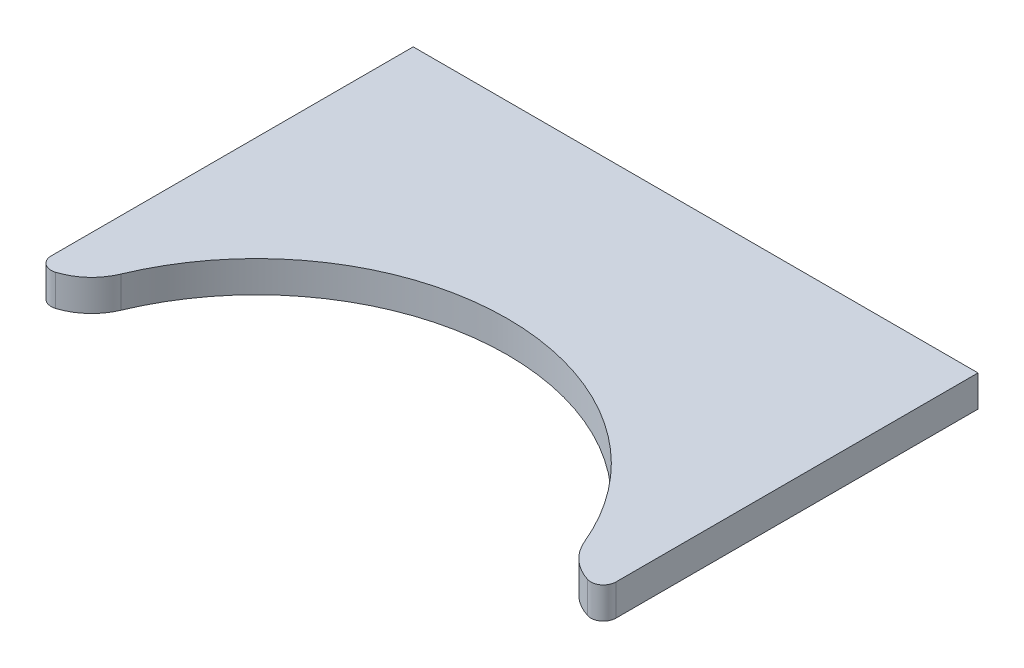
from build123d import *

# Parameters (mm, degrees)
SKETCH1_W           = 57.15
SKETCH1_H           = 38.1
BOSS_EXTRUDE1_DEPTH = 3.175
CUT_EXTRUDE1_DEPTH  = 35.48932806
FILLET3_R           = 1.27


with BuildPart() as part:
    # Sketch1 → Boss-Extrude1 (new body)
    with BuildSketch(Plane(origin=(0, 0, 0), x_dir=(1, 0, 0), z_dir=(0, 1, 0))):
        Rectangle(SKETCH1_W, SKETCH1_H)
    extrude(amount=BOSS_EXTRUDE1_DEPTH)

    # Sketch2 → Cut-Extrude1 (cut, through all)
    with BuildSketch(Plane(origin=(0, 3.175, 0), x_dir=(1, 0, 0), z_dir=(0, 1, 0))):
        with BuildLine():
            Line((-28.575, -19.05), (28.575, -19.05))
            ThreePointArc((28.575, -19.05), (25.492947035, -18.116829448), (23.446153846, -15.630769231))
            ThreePointArc((23.446153846, -15.630769231), (0, 0), (-23.446153846, -15.630769231))
            ThreePointArc((-23.446153846, -15.630769231), (-25.492947035, -18.116829448), (-28.575, -19.05))
        make_face()
    extrude(amount=-CUT_EXTRUDE1_DEPTH, mode=Mode.SUBTRACT)

    # Fillet3
    fillet3_edges = [part.edges().sort_by_distance(p)[0] for p in [
        (28.575, 1.5875, 19.05),
        (-28.575, 1.5875, 19.05),
    ]]
    fillet(fillet3_edges, radius=FILLET3_R)


solid = part.part
